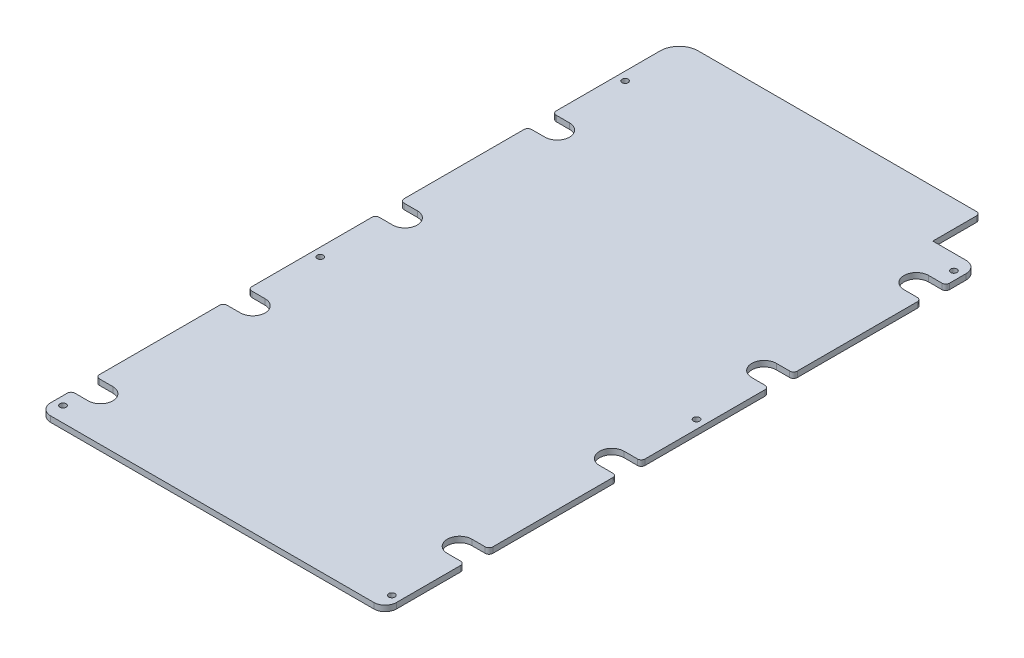
from build123d import *

# Parameters (mm, degrees)
BOSS_EXTRUDE1_DEPTH       = 3
FILLET1_R                 = 10
FILLET2_R                 = 6
F_4_CLEARANCE_HOLE1_D     = 3.2639
F_4_CLEARANCE_HOLE1_DEPTH = 3
F_4_CLEARANCE_HOLE1_TIP   = 0.980574487
FILLET3_R                 = 2


with BuildPart() as part:
    # Sketch1 → Boss-Extrude1 (new body)
    with BuildSketch(Plane(origin=(0, 0, 0), x_dir=(1, 0, 0), z_dir=(0, 1, 0))):
        with BuildLine():
            Line((-91.15, 34.109827366), (-82.15, 34.109827366))
            ThreePointArc((-82.15, 34.109827366), (-75.65, 27.609827366), (-82.15, 21.109827366))
            Line((-82.15, 21.109827366), (-91.15, 21.109827366))
            Line((-91.15, 21.109827366), (-91.15, -46.140172634))
            Line((-91.15, -46.140172634), (-82.15, -46.140172634))
            ThreePointArc((-82.15, -46.140172634), (-75.65, -52.640172634), (-82.15, -59.140172634))
            Line((-82.15, -59.140172634), (-91.15, -59.140172634))
            Line((-91.15, -59.140172634), (-91.15, -126.390172634))
            Line((-91.15, -126.390172634), (-82.15, -126.390172634))
            ThreePointArc((-82.15, -126.390172634), (-75.65, -132.890172634), (-82.15, -139.390172634))
            Line((-82.15, -139.390172634), (-91.15, -139.390172634))
            Line((-91.15, -139.390172634), (-91.15, -156.140172634))
            Line((-91.15, -156.140172634), (91.15, -156.140172634))
            Line((91.15, -156.140172634), (91.15, -114.390172634))
            Line((91.15, -114.390172634), (82.15, -114.390172634))
            ThreePointArc((82.15, -114.390172634), (75.65, -107.890172634), (82.15, -101.390172634))
            Line((82.15, -101.390172634), (91.15, -101.390172634))
            Line((91.15, -101.390172634), (91.15, -34.140172634))
            Line((91.15, -34.140172634), (82.15, -34.140172634))
            ThreePointArc((82.15, -34.140172634), (75.65, -27.640172634), (82.15, -21.140172634))
            Line((82.15, -21.140172634), (91.15, -21.140172634))
            Line((91.15, -21.140172634), (91.15, 46.109827366))
            Line((91.15, 46.109827366), (82.15, 46.109827366))
            ThreePointArc((82.15, 46.109827366), (75.65, 52.609827366), (82.15, 59.109827366))
            Line((82.15, 59.109827366), (91.15, 59.109827366))
            Line((91.15, 59.109827366), (91.15, 126.359827366))
            Line((91.15, 126.359827366), (82.15, 126.359827366))
            ThreePointArc((82.15, 126.359827366), (75.65, 132.859827366), (82.15, 139.359827366))
            Line((82.15, 139.359827366), (91.15, 139.359827366))
            Line((91.15, 139.359827366), (91.15, 156.140172634))
            Line((91.15, 156.140172634), (67.54, 156.140172634))
            Line((67.54, 156.140172634), (67.54, 181.140172634))
            Line((67.54, 181.140172634), (-91.15, 181.140172634))
            Line((-91.15, 181.140172634), (-91.15, 114.359827366))
            Line((-91.15, 114.359827366), (-82.15, 114.359827366))
            ThreePointArc((-82.15, 114.359827366), (-75.65, 107.859827366), (-82.15, 101.359827366))
            Line((-82.15, 101.359827366), (-91.15, 101.359827366))
            Line((-91.15, 101.359827366), (-91.15, 34.109827366))
        make_face()
    extrude(amount=BOSS_EXTRUDE1_DEPTH)

    # Fillet1
    fillet1_edges = [part.edges().sort_by_distance(p)[0] for p in [
        (-91.15, 1.5, -181.140172634),
    ]]
    fillet(fillet1_edges, radius=FILLET1_R)

    # Fillet2
    fillet2_edges = [part.edges().sort_by_distance(p)[0] for p in [
        (91.15, 1.5, 156.140172634),
        (-91.15, 1.5, 156.140172634),
        (91.15, 1.5, -156.140172634),
    ]]
    fillet(fillet2_edges, radius=FILLET2_R)

    # #4 Clearance Hole1
    with Locations(Plane(origin=(0, 3, 0), x_dir=(1, 0, 0), z_dir=(0, 1, 0))):
        with Locations((86.65, 148.140172634), (-86.65, -148.140172634), (-86.65, -12.515172634), (-86.65, 148.140172634), (86.65, 12.484827366), (86.65, -148.140172634)):
            Hole(F_4_CLEARANCE_HOLE1_D / 2, depth=F_4_CLEARANCE_HOLE1_DEPTH)
            with Locations((0, 0, -(F_4_CLEARANCE_HOLE1_DEPTH + F_4_CLEARANCE_HOLE1_TIP / 2))):  # 118° drill point
                Cone(0, F_4_CLEARANCE_HOLE1_D / 2, F_4_CLEARANCE_HOLE1_TIP, mode=Mode.SUBTRACT)

    # Fillet3
    fillet3_edges = [part.edges().sort_by_distance(p)[0] for p in [
        (-91.15, 1.5, -101.359827366),
        (-91.15, 1.5, -114.359827366),
        (-91.15, 1.5, -21.109827366),
        (-91.15, 1.5, -34.109827366),
        (-91.15, 1.5, 59.140172634),
        (-91.15, 1.5, 46.140172634),
        (-91.15, 1.5, 139.390172634),
        (-91.15, 1.5, 126.390172634),
        (91.15, 1.5, 101.390172634),
        (91.15, 1.5, 114.390172634),
        (91.15, 1.5, 34.140172634),
        (91.15, 1.5, 21.140172634),
        (91.15, 1.5, -46.109827366),
        (91.15, 1.5, -59.109827366),
        (91.15, 1.5, -126.359827366),
        (91.15, 1.5, -139.359827366),
        (67.54, 1.5, -181.140172634),
    ]]
    fillet(fillet3_edges, radius=FILLET3_R)


solid = part.part
